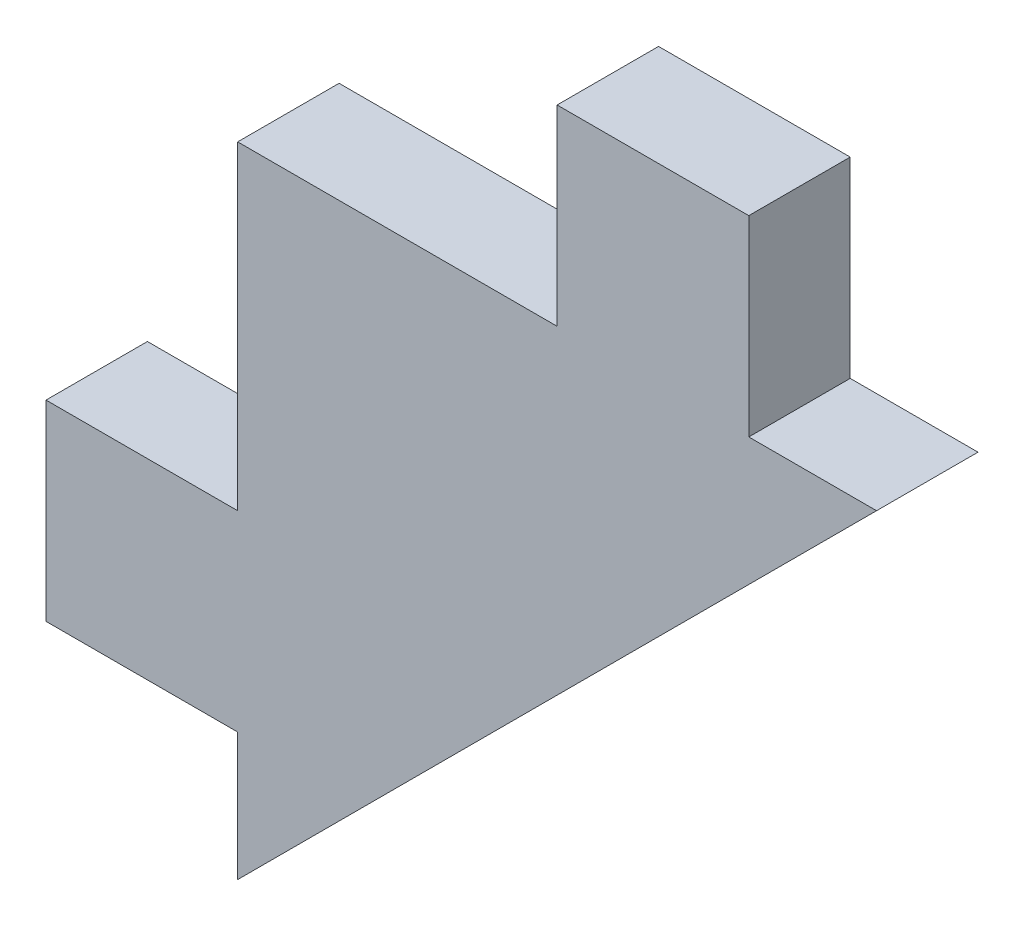
from build123d import *

# Parameters (mm, degrees)
BOSS_EXTRUDE1_DEPTH = 3.175


with BuildPart() as part:
    # Sketch2 → Boss-Extrude1 (new body)
    with BuildSketch(Plane.XY):
        Polygon((0, 20), (0, 10), (-6, 10), (-6, 4), (0, 4), (0, 0), (20, 20), (16, 20), (16, 26), (10, 26), (10, 20), align=None)
    extrude(amount=BOSS_EXTRUDE1_DEPTH)


solid = part.part
